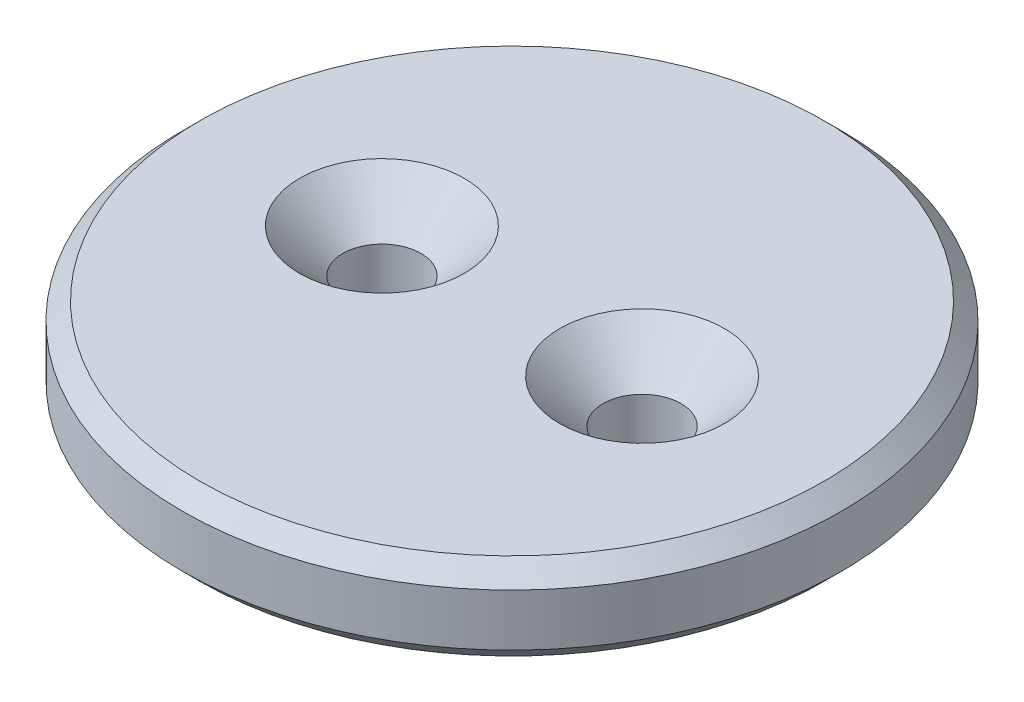
from build123d import *

# Parameters (mm, degrees)
SKETCH1_R           = 19
BOSS_EXTRUDE1_DEPTH = 5
CHAMFER2_SIZE       = 1
SKETCH2_R           = 2.25
CUT_EXTRUDE1_DEPTH  = 28.331300737
CHAMFER1_SIZE       = 2.5
SKETCH3_W           = 25
SKETCH3_H           = 13
BOSS_EXTRUDE2_DEPTH = 2
SKETCH4_R           = 2.25
CUT_EXTRUDE2_DEPTH  = 28.331300737


with BuildPart() as part:
    # Sketch1 → Boss-Extrude1 (new body)
    with BuildSketch(Plane(origin=(0, 0, 0), x_dir=(1, 0, 0), z_dir=(0, 1, 0))):
        Circle(SKETCH1_R)
    extrude(amount=BOSS_EXTRUDE1_DEPTH)

    # Chamfer2
    chamfer2_edges = [part.edges().sort_by_distance(p)[0] for p in [
        (-19, 0, 0),
        (-19, 5, 0),
    ]]
    chamfer(chamfer2_edges, length=CHAMFER2_SIZE)

    # Sketch2 → Cut-Extrude1 (cut, through all)
    with BuildSketch(Plane(origin=(0, 5, 0), x_dir=(1, 0, 0), z_dir=(0, 1, 0))):
        with Locations((-7.5, 0)):
            Circle(SKETCH2_R)
        with Locations((7.5, 0)):
            Circle(SKETCH2_R)
    extrude(amount=-CUT_EXTRUDE1_DEPTH, mode=Mode.SUBTRACT)

    # Chamfer1
    chamfer1_edges = [part.edges().sort_by_distance(p)[0] for p in [
        (5.25, 5, 0),
        (-9.75, 5, 0),
    ]]
    chamfer(chamfer1_edges, length=CHAMFER1_SIZE)

    # Sketch3 → Boss-Extrude2 (add)
    with BuildSketch(Plane.XZ):
        Rectangle(SKETCH3_W, SKETCH3_H)
    extrude(amount=BOSS_EXTRUDE2_DEPTH)

    # Sketch4 → Cut-Extrude2 (cut, through all)
    with BuildSketch(Plane(origin=(0, 0, 0), x_dir=(1, 0, 0), z_dir=(0, 1, 0))):
        with Locations((7.5, 0)):
            Circle(SKETCH4_R)
        with Locations((-7.5, 0)):
            Circle(SKETCH4_R)
    extrude(amount=-CUT_EXTRUDE2_DEPTH, mode=Mode.SUBTRACT)


solid = part.part
